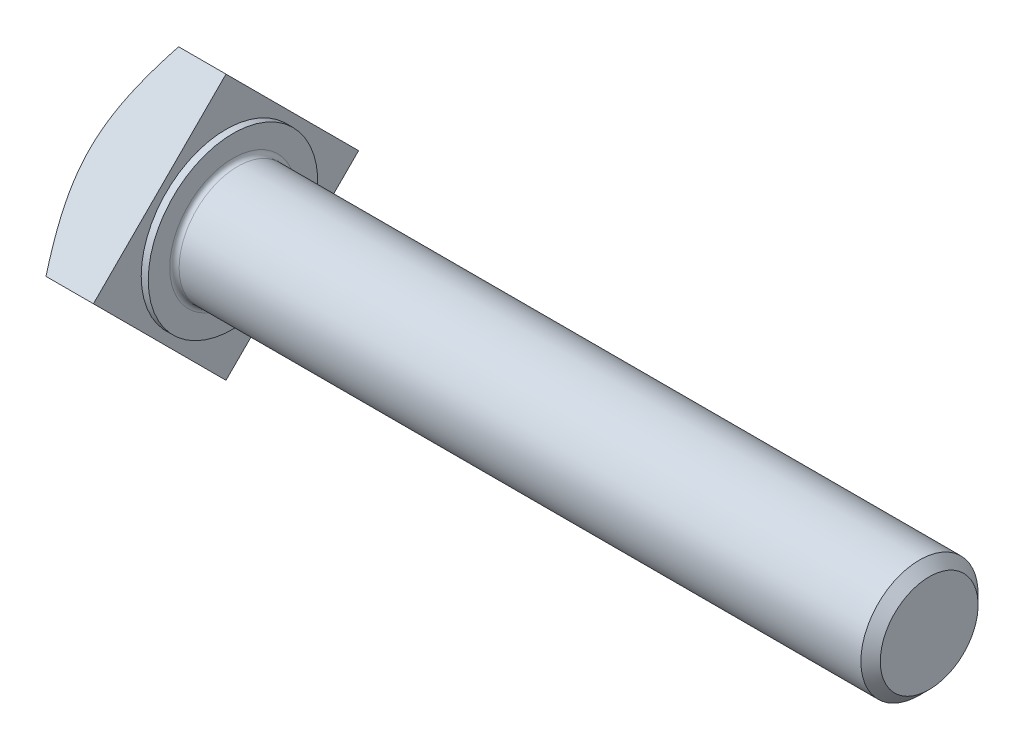
from build123d import *

# Parameters (mm, degrees)
BASEHEAD_DEPTH = 6.4
FILLET1_R      = 0.4


with BuildPart() as part:
    # BaseHeadSke → BaseHead (new body)
    with BuildSketch(Plane(origin=(0, 0, 0), x_dir=(0, 0, -1), z_dir=(1, 0, 0))):
        Polygon((0, 11.313708499), (11.313708499, 0), (0, -11.313708499), (-11.313708499, 0), align=None)
    extrude(amount=BASEHEAD_DEPTH)

    # BodySke → BaseBody (revolve)
    with BuildSketch(Plane.XY):
        Polygon((6.4, 0), (6.4, 7.235), (7, 7.235), (7, 5), (65.572, 5), (66.4, 4.172), (66.4, 0), align=None)
    revolve(axis=Axis((0, 0, 0), (1, 0, 0)))

    # Fillet1
    fillet1_edges = [part.edges().sort_by_distance(p)[0] for p in [
        (7, -5, 0),
    ]]
    fillet(fillet1_edges, radius=FILLET1_R)

    # HeadChamferSke → HeadChamfer (revolve, cut)
    with BuildSketch(Plane.XY):
        Polygon((0, 11.313708499), (0, 7.235), (2.35484345, 11.313708499), align=None)
    revolve(axis=Axis((0, 0, 0), (1, 0, 0)), mode=Mode.SUBTRACT)


solid = part.part
